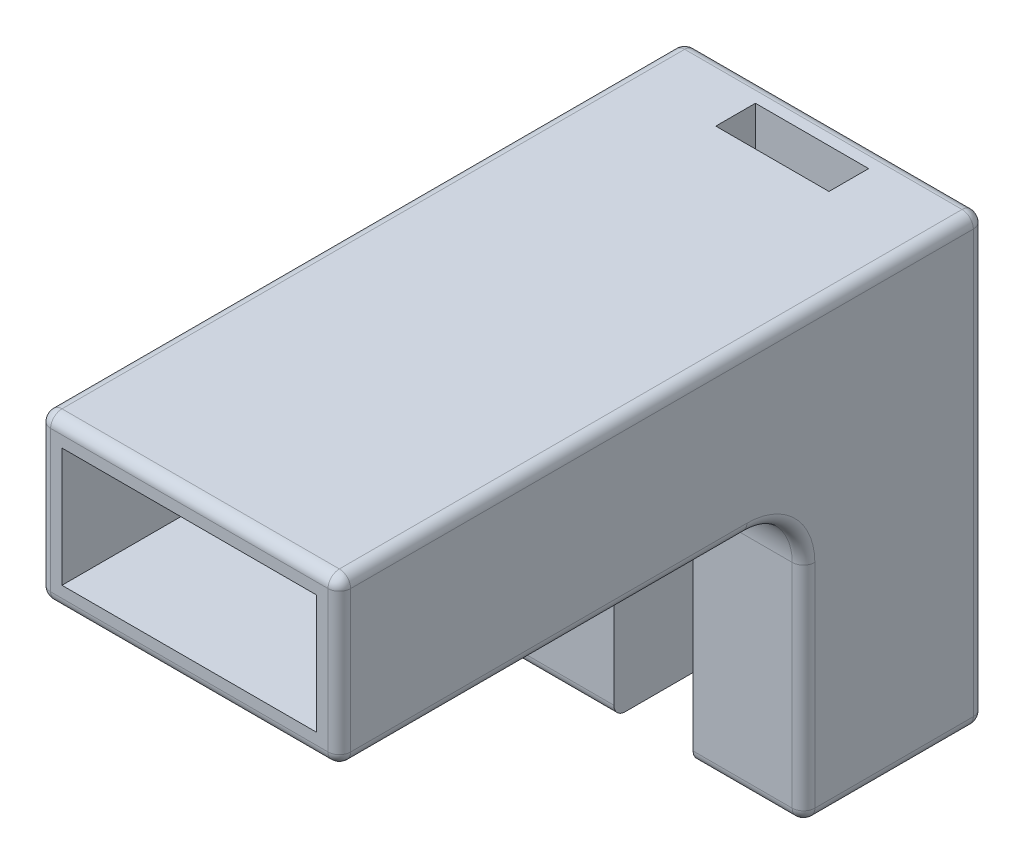
from build123d import *

# Parameters (mm, degrees)
SKETCH_2_W          = 26.5
SKETCH_2_H          = 14.5
EXTRUDE_1_DEPTH     = 57
SKETCH_6_W          = 22.5
SKETCH_6_H          = 10.5
CUT_EXTRUDE_1_DEPTH = 49
SKETCH_7_W          = 26.5
SKETCH_7_H          = 16
EXTRUDE_2_DEPTH     = 24.8
FILLET_1_R          = 5
FILLET_2_R          = 1
FILLET_4_R          = 1
FILLET_5_R          = 1
FILLET_6_R          = 1
CUT_EXTRUDE_2_DEPTH = 20
SKETCH_10_W         = 10
SKETCH_10_H         = 3.5
CUT_EXTRUDE_3_DEPTH = 40


with BuildPart() as part:
    # ｽｹｯﾁ2 → ﾎﾞｽ - 押し出し1 (new body)
    with BuildSketch(Plane.XY):
        with Locations((13.25, 7.25)):
            Rectangle(SKETCH_2_W, SKETCH_2_H)
    extrude(amount=EXTRUDE_1_DEPTH)

    # ｽｹｯﾁ6 → ｶｯﾄ - 押し出し1 (cut)
    with BuildSketch(Plane.XY.offset(57)):
        with Locations((13.25, 7.25)):
            Rectangle(SKETCH_6_W, SKETCH_6_H)
    extrude(amount=-CUT_EXTRUDE_1_DEPTH, mode=Mode.SUBTRACT)

    # ｽｹｯﾁ7 → ﾎﾞｽ - 押し出し2 (add)
    with BuildSketch(Plane.XZ):
        with Locations((13.25, 8)):
            Rectangle(SKETCH_7_W, SKETCH_7_H)
    extrude(amount=EXTRUDE_2_DEPTH)

    # ﾌｨﾚｯﾄ1
    fillet_1_edges = [part.edges().sort_by_distance(p)[0] for p in [
        (13.25, 0, 16),
    ]]
    fillet(fillet_1_edges, radius=FILLET_1_R)

    # ﾌｨﾚｯﾄ2
    fillet_2_edges = [part.edges().sort_by_distance(p)[0] for p in [
        (26.5, 14.5, 28.5),
    ]]
    fillet(fillet_2_edges, radius=FILLET_2_R)

    # ﾌｨﾚｯﾄ4
    fillet_4_edges = [part.edges().sort_by_distance(p)[0] for p in [
        (26.5, -14.9, 16),
        (26.5, -24.8, 8),
        (26.5, -1.464466094, 17.464466094),
        (12.75, 14.5, 0),
        (26.207106781, 14.207106781, 0),
        (26.5, -5.65, 0),
        (26.5, 0, 39),
    ]]
    fillet(fillet_4_edges, radius=FILLET_4_R)

    # ﾌｨﾚｯﾄ5
    # the kernel refuses this fillet: 1 mm, written as the material it takes off along each edge
    with BuildSketch(Plane(origin=(25.5, -23.8, 15), x_dir=(0, -1, 0), z_dir=(0, 0, 1))) as fillet_5_piece_1_section:
        Polygon((0, 0), (FILLET_5_R, 0), (FILLET_5_R, FILLET_5_R), (0, FILLET_5_R), align=None)
    fillet_5_piece_1 = extrude(amount=FILLET_5_R, mode=Mode.PRIVATE)
    fillet_5_piece_1 = fillet_5_piece_1 - Plane(origin=(25.5, -23.8, 15), x_dir=(-0.7071067811865475, 0.7071067811865475, 0), z_dir=(0, 0, 1)) * Sphere(FILLET_5_R, mode=Mode.PRIVATE)
    add(fillet_5_piece_1, mode=Mode.SUBTRACT)
    with BuildSketch(Plane(origin=(25.5, -23.8, 1), x_dir=(0, -1, 0), z_dir=(0, 0, -1))) as fillet_5_piece_2_section:
        Polygon((0, 0), (FILLET_5_R, 0), (FILLET_5_R, -FILLET_5_R), (0, -FILLET_5_R), align=None)
    fillet_5_piece_2 = extrude(amount=FILLET_5_R, mode=Mode.PRIVATE)
    fillet_5_piece_2 = fillet_5_piece_2 - Plane(origin=(25.5, -23.8, 1), x_dir=(-0.7071067811865475, 0.7071067811865475, 0), z_dir=(0, 0, -1)) * Sphere(FILLET_5_R, mode=Mode.PRIVATE)
    add(fillet_5_piece_2, mode=Mode.SUBTRACT)
    with BuildSketch(Plane(origin=(1, -23.8, 15), x_dir=(-1, 0, 0), z_dir=(0, -1, 0))) as fillet_5_piece_3_section:
        Polygon((0, 0), (FILLET_5_R, 0), (FILLET_5_R, -FILLET_5_R), (0, -FILLET_5_R), align=None)
    fillet_5_piece_3 = extrude(amount=FILLET_5_R, mode=Mode.PRIVATE)
    fillet_5_piece_3 = fillet_5_piece_3 - Plane(origin=(1, -23.8, 15), x_dir=(0.7071067811865475, 0, -0.7071067811865475), z_dir=(0, -1, 0)) * Sphere(FILLET_5_R, mode=Mode.PRIVATE)
    add(fillet_5_piece_3, mode=Mode.SUBTRACT)
    with BuildSketch(Plane(origin=(1, -23.8, 1), x_dir=(-1, 0, 0), z_dir=(0, 0, -1))) as fillet_5_piece_4_section:
        Polygon((0, 0), (FILLET_5_R, 0), (FILLET_5_R, -FILLET_5_R), (0, -FILLET_5_R), align=None)
    fillet_5_piece_4 = extrude(amount=FILLET_5_R, mode=Mode.PRIVATE)
    fillet_5_piece_4 = fillet_5_piece_4 - Plane(origin=(1, -23.8, 1), x_dir=(0.7071067811865475, 0.7071067811865475, 0), z_dir=(0, 0, -1)) * Sphere(FILLET_5_R, mode=Mode.PRIVATE)
    add(fillet_5_piece_4, mode=Mode.SUBTRACT)
    with BuildSketch(Plane(origin=(0, -5, 16), x_dir=(0, 0, -1), z_dir=(0, -1, 0))) as fillet_5_piece_5:
        with BuildLine():
            CenterArc((FILLET_5_R, FILLET_5_R), FILLET_5_R, 180, 90)
            Line((0, FILLET_5_R), (0, 0))
            Line((0, 0), (FILLET_5_R, 0))
        make_face()
    extrude(amount=18.8, mode=Mode.SUBTRACT)
    with BuildSketch(Plane(origin=(0, -24.8, 15), x_dir=(0, 1, 0), z_dir=(0, 0, -1))) as fillet_5_piece_6:
        with BuildLine():
            CenterArc((FILLET_5_R, FILLET_5_R), FILLET_5_R, 180, 90)
            Line((0, FILLET_5_R), (0, 0))
            Line((0, 0), (FILLET_5_R, 0))
        make_face()
    extrude(amount=14, mode=Mode.SUBTRACT)
    with BuildSketch(Plane(origin=(1, -24.8, 0), x_dir=(0, 1, 0), z_dir=(1, 0, 0)), Plane(origin=(25.5, -24.8, 16), x_dir=(0, 1, 0), z_dir=(-1, 0, 0))) as fillet_5_piece_7:
        with BuildLine():
            CenterArc((FILLET_5_R, FILLET_5_R), FILLET_5_R, 180, 90)
            Line((0, FILLET_5_R), (0, 0))
            Line((0, 0), (FILLET_5_R, 0))
        make_face()
    extrude(amount=24.5, mode=Mode.SUBTRACT)
    with BuildSketch(Plane(origin=(0, -5, 21), x_dir=(0, 1, 0), z_dir=(0, 0, 1))) as fillet_5_piece_8:
        with BuildLine():
            CenterArc((5 + FILLET_5_R, -FILLET_5_R), FILLET_5_R, 90, 90)
            Line((5, -FILLET_5_R), (5, 0))
            Line((5, 0), (5 + FILLET_5_R, 0))
        make_face()
    revolve(axis=Axis((0, -5, 21), (-1, 0, 0)), revolution_arc=90, mode=Mode.SUBTRACT)
    with BuildSketch(Plane(origin=(0, 13.5, 0), x_dir=(0, 0, 1), z_dir=(0, -1, 0))) as fillet_5_piece_9:
        with BuildLine():
            CenterArc((FILLET_5_R, -FILLET_5_R), FILLET_5_R, 90, 90)
            Line((0, -FILLET_5_R), (0, 0))
            Line((0, 0), (FILLET_5_R, 0))
        make_face()
    extrude(amount=37.3, mode=Mode.SUBTRACT)
    with BuildSketch(Plane(origin=(0, 13.5, 1), x_dir=(0, 0, -1), z_dir=(0, -1, 0))) as fillet_5_piece_10:
        with BuildLine():
            CenterArc((1 - FILLET_5_R, FILLET_5_R), FILLET_5_R, 270, 90)
            Line((1, FILLET_5_R), (1, 0))
            Line((1, 0), (1 - FILLET_5_R, 0))
        make_face()
    revolve(axis=Axis((0, 13.5, 1), (1, 0, 0)), revolution_arc=90, mode=Mode.SUBTRACT)
    with BuildSketch(Plane(origin=(0, 14.5, 1), x_dir=(1, 0, 0), z_dir=(0, 0, 1))) as fillet_5_piece_11:
        with BuildLine():
            CenterArc((FILLET_5_R, -FILLET_5_R), FILLET_5_R, 90, 90)
            Line((0, -FILLET_5_R), (0, 0))
            Line((0, 0), (FILLET_5_R, 0))
        make_face()
    extrude(amount=58.5, mode=Mode.SUBTRACT)
    with BuildSketch(Plane(origin=(0, 0, 21), x_dir=(1, 0, 0), z_dir=(0, 0, 1))) as fillet_5_piece_12:
        with BuildLine():
            CenterArc((FILLET_5_R, FILLET_5_R), FILLET_5_R, 180, 90)
            Line((0, FILLET_5_R), (0, 0))
            Line((0, 0), (FILLET_5_R, 0))
        make_face()
    extrude(amount=38.5, mode=Mode.SUBTRACT)

    # ﾌｨﾚｯﾄ6
    fillet_6_edges = [part.edges().sort_by_distance(p)[0] for p in [
        (13.25, 14.5, 57),
        (26.207106781, 14.207106781, 57),
        (26.5, 7.25, 57),
        (26.207106781, 0.292893219, 57),
        (0, 7.25, 57),
        (13.25, 0, 57),
        (0.292893219, 0.292893219, 57),
        (0.292893219, 14.207106781, 57),
    ]]
    fillet(fillet_6_edges, radius=FILLET_6_R)

    # ｽｹｯﾁ8 → ｶｯﾄ - 押し出し2 (cut)
    with BuildSketch(Plane.XZ.offset(24.8)):
        Polygon((9.75, 16), (16.75, 16), (16.75, 6.5), (15.25, 6.5), (15.25, 5.5), (18.25, 5.5), (18.25, 2), (8.25, 2), (8.25, 5.5), (11.25, 5.5), (11.25, 6.5), (9.75, 6.5), align=None)
    extrude(amount=-CUT_EXTRUDE_2_DEPTH, mode=Mode.SUBTRACT)

    # ｽｹｯﾁ10 → ｶｯﾄ - 押し出し3 (cut)
    with BuildSketch(Plane.XZ.offset(24.8)):
        with Locations((13.25, 3.75)):
            Rectangle(SKETCH_10_W, SKETCH_10_H)
    extrude(amount=-CUT_EXTRUDE_3_DEPTH, mode=Mode.SUBTRACT)


solid = part.part
